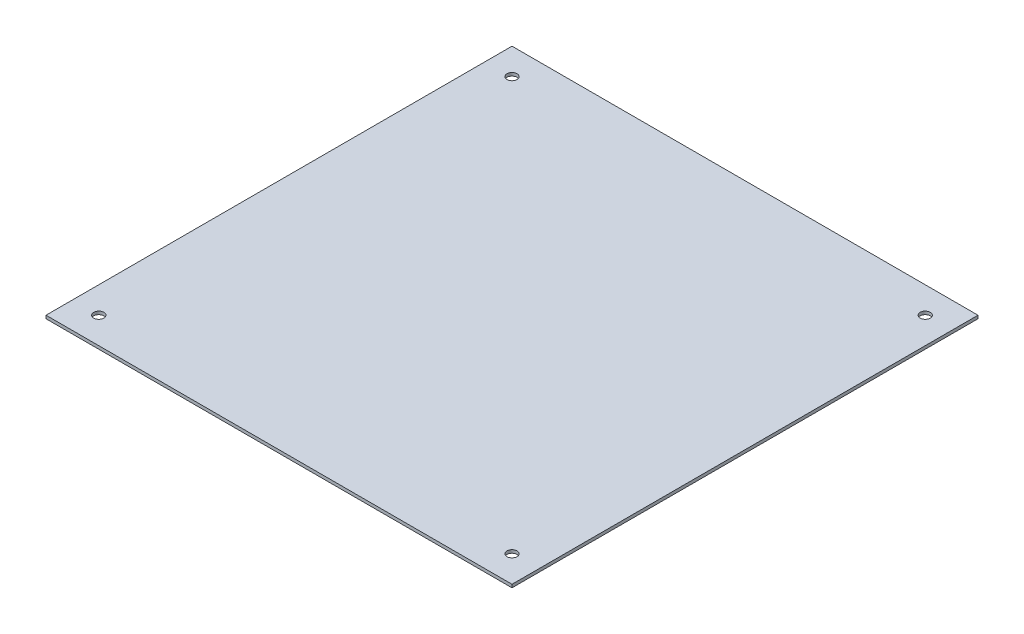
from build123d import *

# Parameters (mm, degrees)
SKETCH1_W                  = 300
SKETCH1_H                  = 300
BASE_FLANGE1_DEPTH         = 2
F_6_5_6_5_DIAMETER_HOLE1_D = 6.5


# Sheet-metal steps are written as plain solids
with BuildPart() as part:
    # Sketch1 → Base-Flange1 (new body)
    with BuildSketch(Plane(origin=(0, 0, 0), x_dir=(1, 0, 0), z_dir=(0, 1, 0))):
        Rectangle(SKETCH1_W, SKETCH1_H)
    extrude(amount=-BASE_FLANGE1_DEPTH)

    # Ø6.5 (6.5) Diameter Hole1 (through all)
    with Locations(Plane(origin=(0, 0, 0), x_dir=(1, 0, 0), z_dir=(0, 1, 0))):
        with Locations((-133, 133), (133, 133), (133, -133), (-133, -133)):
            Hole(F_6_5_6_5_DIAMETER_HOLE1_D / 2)


solid = part.part
